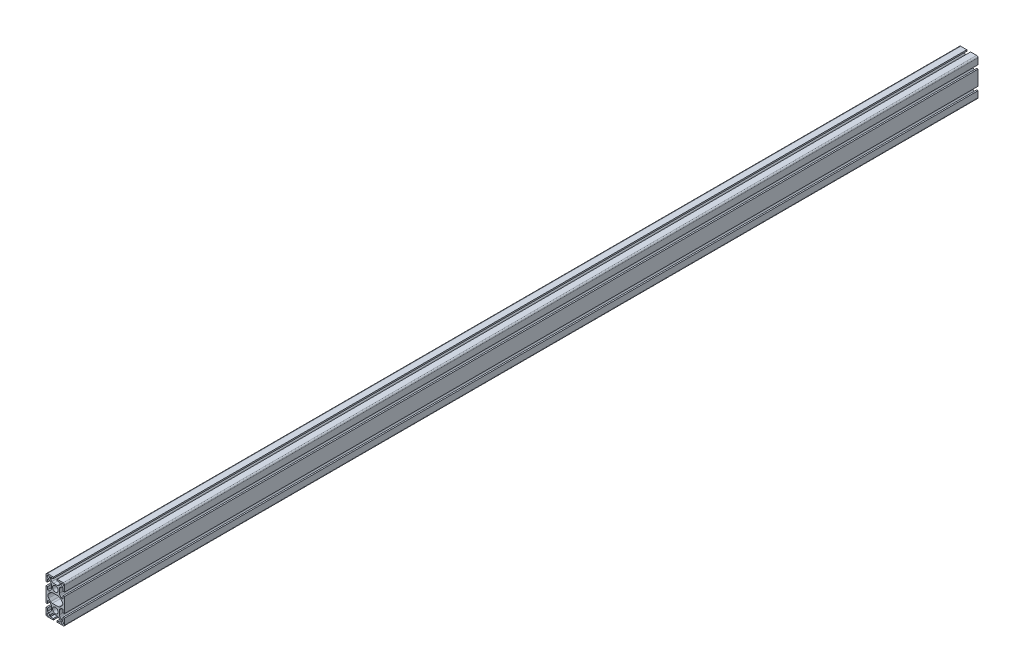
from build123d import *

# Parameters (mm, degrees)
SKETCH1_R           = 2.5
SKETCH1_R_2         = 6
BOSS_EXTRUDE1_DEPTH = 1961


with BuildPart() as part:
    # Sketch1 → Boss-Extrude1 (new body)
    with BuildSketch(Plane.XY):
        with BuildLine():
            Line((-17, -40), (-4.1, -40))
            Line((-4.1, -40), (-4.1, -37))
            Line((-4.1, -37), (-10.5, -37))
            Line((-10.5, -37), (-10.5, -33.6627417))
            ThreePointArc((-10.5, -33.6627417), (-10.378207252, -33.050448208), (-10.03137085, -32.53137085))
            Line((-10.03137085, -32.53137085), (-7.464466094, -29.964466094))
            ThreePointArc((-7.464466094, -29.964466094), (-5.84234935, -28.880602337), (-3.928932188, -28.5))
            Line((-3.928932188, -28.5), (3.928932188, -28.5))
            ThreePointArc((3.928932188, -28.5), (5.84234935, -28.880602337), (7.464466094, -29.964466094))
            Line((7.464466094, -29.964466094), (10.03137085, -32.53137085))
            ThreePointArc((10.03137085, -32.53137085), (10.378207252, -33.050448208), (10.5, -33.6627417))
            Line((10.5, -33.6627417), (10.5, -37))
            Line((10.5, -37), (4.1, -37))
            Line((4.1, -37), (4.1, -40))
            Line((4.1, -40), (17, -40))
            ThreePointArc((17, -40), (19.121320344, -39.121320344), (20, -37))
            Line((20, -37), (20, -24.1))
            Line((20, -24.1), (17, -24.1))
            Line((17, -24.1), (17, -30.5))
            Line((17, -30.5), (13.6627417, -30.5))
            ThreePointArc((13.6627417, -30.5), (13.050448208, -30.378207252), (12.53137085, -30.03137085))
            Line((12.53137085, -30.03137085), (9.964466094, -27.464466094))
            ThreePointArc((9.964466094, -27.464466094), (8.880602337, -25.84234935), (8.5, -23.928932188))
            Line((8.5, -23.928932188), (8.5, -16.071067812))
            ThreePointArc((8.5, -16.071067812), (8.880602337, -14.15765065), (9.964466094, -12.535533906))
            Line((9.964466094, -12.535533906), (12.53137085, -9.96862915))
            ThreePointArc((12.53137085, -9.96862915), (13.050448208, -9.621792748), (13.6627417, -9.5))
            Line((13.6627417, -9.5), (17, -9.5))
            Line((17, -9.5), (17, -15.9))
            Line((17, -15.9), (20, -15.9))
            Line((20, -15.9), (20, 15.9))
            Line((20, 15.9), (17, 15.9))
            Line((17, 15.9), (17, 9.5))
            Line((17, 9.5), (13.6627417, 9.5))
            ThreePointArc((13.6627417, 9.5), (13.050448208, 9.621792748), (12.53137085, 9.96862915))
            Line((12.53137085, 9.96862915), (9.964466094, 12.535533906))
            ThreePointArc((9.964466094, 12.535533906), (8.880602337, 14.15765065), (8.5, 16.071067812))
            Line((8.5, 16.071067812), (8.5, 23.928932188))
            ThreePointArc((8.5, 23.928932188), (8.880602337, 25.84234935), (9.964466094, 27.464466094))
            Line((9.964466094, 27.464466094), (12.53137085, 30.03137085))
            ThreePointArc((12.53137085, 30.03137085), (13.050448208, 30.378207252), (13.6627417, 30.5))
            Line((13.6627417, 30.5), (17, 30.5))
            Line((17, 30.5), (17, 24.1))
            Line((17, 24.1), (20, 24.1))
            Line((20, 24.1), (20, 37))
            ThreePointArc((20, 37), (19.121320344, 39.121320344), (17, 40))
            Line((17, 40), (4.1, 40))
            Line((4.1, 40), (4.1, 37))
            Line((4.1, 37), (10.5, 37))
            Line((10.5, 37), (10.5, 33.6627417))
            ThreePointArc((10.5, 33.6627417), (10.378207252, 33.050448208), (10.03137085, 32.53137085))
            Line((10.03137085, 32.53137085), (7.464466094, 29.964466094))
            ThreePointArc((7.464466094, 29.964466094), (5.84234935, 28.880602337), (3.928932188, 28.5))
            Line((3.928932188, 28.5), (-3.928932188, 28.5))
            ThreePointArc((-3.928932188, 28.5), (-5.84234935, 28.880602337), (-7.464466094, 29.964466094))
            Line((-7.464466094, 29.964466094), (-10.03137085, 32.53137085))
            ThreePointArc((-10.03137085, 32.53137085), (-10.378207252, 33.050448208), (-10.5, 33.6627417))
            Line((-10.5, 33.6627417), (-10.5, 37))
            Line((-10.5, 37), (-4.1, 37))
            Line((-4.1, 37), (-4.1, 40))
            Line((-4.1, 40), (-17, 40))
            ThreePointArc((-17, 40), (-19.121320344, 39.121320344), (-20, 37))
            Line((-20, 37), (-20, 24.1))
            Line((-20, 24.1), (-17, 24.1))
            Line((-17, 24.1), (-17, 30.5))
            Line((-17, 30.5), (-13.6627417, 30.5))
            ThreePointArc((-13.6627417, 30.5), (-13.050448208, 30.378207252), (-12.53137085, 30.03137085))
            Line((-12.53137085, 30.03137085), (-9.964466094, 27.464466094))
            ThreePointArc((-9.964466094, 27.464466094), (-8.880602337, 25.84234935), (-8.5, 23.928932188))
            Line((-8.5, 23.928932188), (-8.5, 16.071067812))
            ThreePointArc((-8.5, 16.071067812), (-8.880602337, 14.15765065), (-9.964466094, 12.535533906))
            Line((-9.964466094, 12.535533906), (-12.53137085, 9.96862915))
            ThreePointArc((-12.53137085, 9.96862915), (-13.050448208, 9.621792748), (-13.6627417, 9.5))
            Line((-13.6627417, 9.5), (-17, 9.5))
            Line((-17, 9.5), (-17, 15.9))
            Line((-17, 15.9), (-20, 15.9))
            Line((-20, 15.9), (-20, -15.9))
            Line((-20, -15.9), (-17, -15.9))
            Line((-17, -15.9), (-17, -9.5))
            Line((-17, -9.5), (-13.6627417, -9.5))
            ThreePointArc((-13.6627417, -9.5), (-13.050448208, -9.621792748), (-12.53137085, -9.96862915))
            Line((-12.53137085, -9.96862915), (-9.964466094, -12.535533906))
            ThreePointArc((-9.964466094, -12.535533906), (-8.880602337, -14.15765065), (-8.5, -16.071067812))
            Line((-8.5, -16.071067812), (-8.5, -23.928932188))
            ThreePointArc((-8.5, -23.928932188), (-8.880602337, -25.84234935), (-9.964466094, -27.464466094))
            Line((-9.964466094, -27.464466094), (-12.53137085, -30.03137085))
            ThreePointArc((-12.53137085, -30.03137085), (-13.050448208, -30.378207252), (-13.6627417, -30.5))
            Line((-13.6627417, -30.5), (-17, -30.5))
            Line((-17, -30.5), (-17, -24.1))
            Line((-17, -24.1), (-20, -24.1))
            Line((-20, -24.1), (-20, -37))
            ThreePointArc((-20, -37), (-19.121320344, -39.121320344), (-17, -40))
        make_face()
        with Locations((15, 35)):
            Circle(SKETCH1_R, mode=Mode.SUBTRACT)
        with Locations((15, -35)):
            Circle(SKETCH1_R, mode=Mode.SUBTRACT)
        with Locations((0, 20)):
            Circle(SKETCH1_R_2, mode=Mode.SUBTRACT)
        with Locations((0, -20)):
            Circle(SKETCH1_R_2, mode=Mode.SUBTRACT)
        with Locations((-15, 35)):
            Circle(SKETCH1_R, mode=Mode.SUBTRACT)
        with Locations((-15, -35)):
            Circle(SKETCH1_R, mode=Mode.SUBTRACT)
        with BuildLine():
            Line((-14.242640687, -4.242640687), (-9.949747468, -8.535533906))
            ThreePointArc((-9.949747468, -8.535533906), (-8.327630724, -9.619397663), (-6.414213562, -10))
            Line((-6.414213562, -10), (6.414213562, -10))
            ThreePointArc((6.414213562, -10), (8.327630724, -9.619397663), (9.949747468, -8.535533906))
            Line((9.949747468, -8.535533906), (14.242640687, -4.242640687))
            ThreePointArc((14.242640687, -4.242640687), (16, 0), (14.242640687, 4.242640687))
            Line((14.242640687, 4.242640687), (9.949747468, 8.535533906))
            ThreePointArc((9.949747468, 8.535533906), (8.327630724, 9.619397663), (6.414213562, 10))
            Line((6.414213562, 10), (-6.414213562, 10))
            ThreePointArc((-6.414213562, 10), (-8.327630724, 9.619397663), (-9.949747468, 8.535533906))
            Line((-9.949747468, 8.535533906), (-14.242640687, 4.242640687))
            ThreePointArc((-14.242640687, 4.242640687), (-16, 0), (-14.242640687, -4.242640687))
        make_face(mode=Mode.SUBTRACT)
    extrude(amount=-BOSS_EXTRUDE1_DEPTH)


solid = part.part
